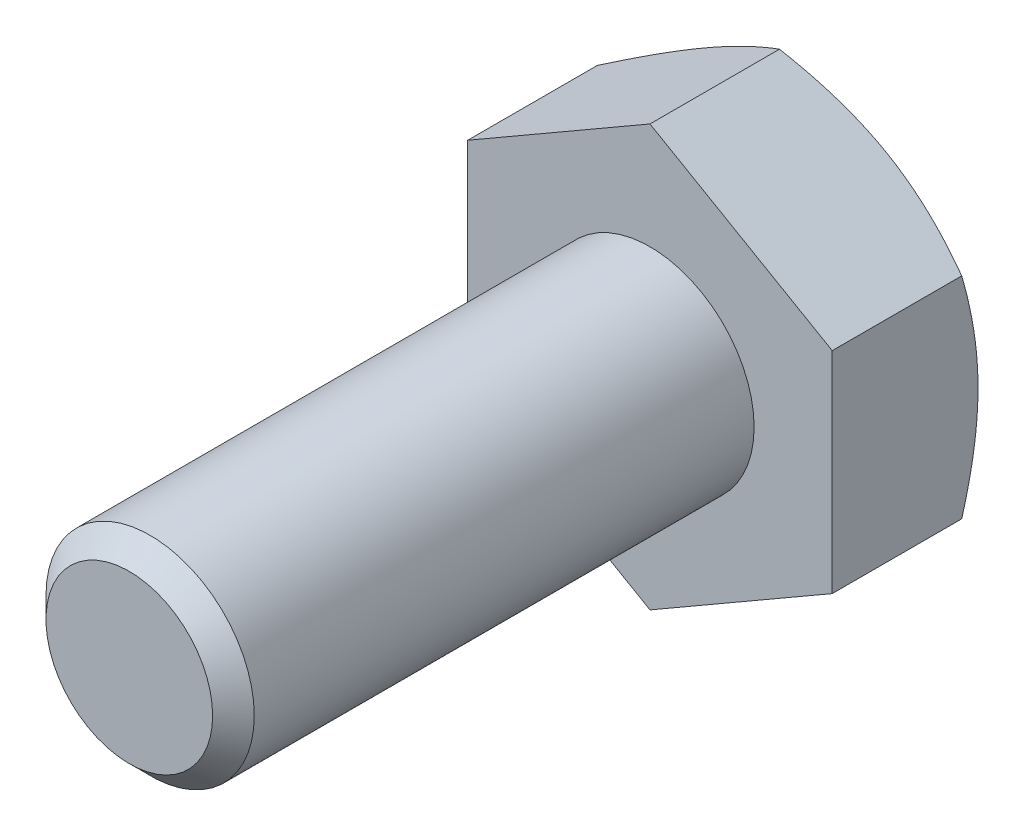
from build123d import *

# Parameters (mm, degrees)
ESQUISSE1_W        = 2
ESQUISSE1_H        = 10
BOSS_EXTRU_1_DEPTH = 2.8


with BuildPart() as part:
    # Esquisse1 → Base-Révolution (revolve)
    with BuildSketch(Plane(origin=(0, 0, 0), x_dir=(1, 0, 0), z_dir=(0, 1, 0))):
        with Locations((1, -5)):
            Rectangle(ESQUISSE1_W, ESQUISSE1_H)
    revolve(axis=Axis((0, 0, 0), (0, 0, 1)))

    # Chanfrein1: read off the stored shape, not the designer's step
    # Chanfrein1 outline → Chanfrein1 (revolve, cut)
    with BuildSketch(Plane.XZ):
        Polygon((2, 10), (1.6, 10), (2, 9.6), align=None)
    revolve(axis=Axis((0, 0, 0), (0, 0, 1)), mode=Mode.SUBTRACT)

    # Esquisse6 → Boss.-Extru.1 (add)
    with BuildSketch(Plane.XY):
        Polygon((3.5, -2.020725942), (3.5, 2.020725942), (0, 4.041451884), (-3.5, 2.020725942), (-3.5, -2.020725942), (0, -4.041451884), align=None)
    extrude(amount=-BOSS_EXTRU_1_DEPTH)

    # Esquisse7 → Enlèvement de matière-Révolution1 (revolve, cut)
    with BuildSketch(Plane(origin=(0, 0, 0), x_dir=(1, 0, 0), z_dir=(0, 1, 0))):
        Polygon((-3.5, 2.8), (-8.349742261, 2.8), (-8.349742261, 0), align=None)
    revolve(axis=Axis((0, 0, -6.239446496), (0, 0, 1)), mode=Mode.SUBTRACT)


solid = part.part
